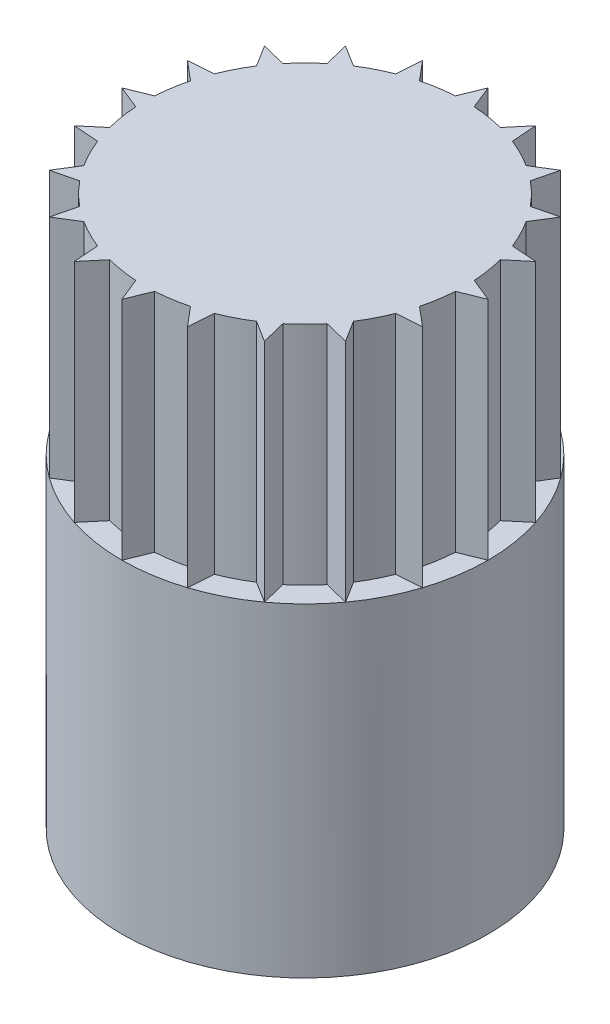
from build123d import *

# Parameters (mm, degrees)
SKETCH1_R           = 4.86
BOSS_EXTRUDE1_DEPTH = 8.6
BOSS_EXTRUDE2_DEPTH = 6


with BuildPart() as part:
    # Sketch1 → Boss-Extrude1 (new body)
    with BuildSketch(Plane(origin=(0, 0, 0), x_dir=(1, 0, 0), z_dir=(0, 1, 0))):
        Circle(SKETCH1_R)
    extrude(amount=BOSS_EXTRUDE1_DEPTH)

    # Sketch2 → Boss-Extrude2 (add)
    with BuildSketch(Plane(origin=(0, 8.6, 0), x_dir=(1, 0, 0), z_dir=(0, 1, 0))):
        with BuildLine():
            Line((0, 4.86), (0.250754017, 4.242596189))
            ThreePointArc((0.250754017, 4.242596189), (0.664846476, 4.197675448), (1.072553081, 4.112436004))
            Line((1.072553081, 4.112436004), (1.501822593, 4.622134669))
            Line((1.501822593, 4.622134669), (1.549515564, 3.957461499))
            ThreePointArc((1.549515564, 3.957461499), (1.929459624, 3.786777728), (2.29087121, 3.57972193))
            Line((2.29087121, 3.57972193), (2.856636326, 3.931822593))
            Line((2.856636326, 3.931822593), (2.696599732, 3.284942904))
            ThreePointArc((2.696599732, 3.284942904), (3.00520382, 3.00520382), (3.284942904, 2.696599732))
            Line((3.284942904, 2.696599732), (3.931822593, 2.856636326))
            Line((3.931822593, 2.856636326), (3.57972193, 2.29087121))
            ThreePointArc((3.57972193, 2.29087121), (3.786777728, 1.929459624), (3.957461499, 1.549515564))
            Line((3.957461499, 1.549515564), (4.622134669, 1.501822593))
            Line((4.622134669, 1.501822593), (4.112436004, 1.072553081))
            ThreePointArc((4.112436004, 1.072553081), (4.197675448, 0.664846476), (4.242596189, 0.250754017))
            Line((4.242596189, 0.250754017), (4.86, 0))
            Line((4.86, 0), (4.242596189, -0.250754017))
            ThreePointArc((4.242596189, -0.250754017), (4.197675448, -0.664846476), (4.112436004, -1.072553081))
            Line((4.112436004, -1.072553081), (4.622134669, -1.501822593))
            Line((4.622134669, -1.501822593), (3.957461499, -1.549515564))
            ThreePointArc((3.957461499, -1.549515564), (3.786777728, -1.929459624), (3.57972193, -2.29087121))
            Line((3.57972193, -2.29087121), (3.931822593, -2.856636326))
            Line((3.931822593, -2.856636326), (3.284942904, -2.696599732))
            ThreePointArc((3.284942904, -2.696599732), (3.00520382, -3.00520382), (2.696599732, -3.284942904))
            Line((2.696599732, -3.284942904), (2.856636326, -3.931822593))
            Line((2.856636326, -3.931822593), (2.29087121, -3.57972193))
            ThreePointArc((2.29087121, -3.57972193), (1.929459624, -3.786777728), (1.549515564, -3.957461499))
            Line((1.549515564, -3.957461499), (1.501822593, -4.622134669))
            Line((1.501822593, -4.622134669), (1.072553081, -4.112436004))
            ThreePointArc((1.072553081, -4.112436004), (0.664846476, -4.197675448), (0.250754017, -4.242596189))
            Line((0.250754017, -4.242596189), (0, -4.86))
            Line((0, -4.86), (-0.250754017, -4.242596189))
            ThreePointArc((-0.250754017, -4.242596189), (-0.664846476, -4.197675448), (-1.072553081, -4.112436004))
            Line((-1.072553081, -4.112436004), (-1.501822593, -4.622134669))
            Line((-1.501822593, -4.622134669), (-1.549515564, -3.957461499))
            ThreePointArc((-1.549515564, -3.957461499), (-1.929459624, -3.786777728), (-2.29087121, -3.57972193))
            Line((-2.29087121, -3.57972193), (-2.856636326, -3.931822593))
            Line((-2.856636326, -3.931822593), (-2.696599732, -3.284942904))
            ThreePointArc((-2.696599732, -3.284942904), (-3.00520382, -3.00520382), (-3.284942904, -2.696599732))
            Line((-3.284942904, -2.696599732), (-3.931822593, -2.856636326))
            Line((-3.931822593, -2.856636326), (-3.57972193, -2.29087121))
            ThreePointArc((-3.57972193, -2.29087121), (-3.786777728, -1.929459624), (-3.957461499, -1.549515564))
            Line((-3.957461499, -1.549515564), (-4.622134669, -1.501822593))
            Line((-4.622134669, -1.501822593), (-4.112436004, -1.072553081))
            ThreePointArc((-4.112436004, -1.072553081), (-4.197675448, -0.664846476), (-4.242596189, -0.250754017))
            Line((-4.242596189, -0.250754017), (-4.86, 0))
            Line((-4.86, 0), (-4.242596189, 0.250754017))
            ThreePointArc((-4.242596189, 0.250754017), (-4.197675448, 0.664846476), (-4.112436004, 1.072553081))
            Line((-4.112436004, 1.072553081), (-4.622134669, 1.501822593))
            Line((-4.622134669, 1.501822593), (-3.957461499, 1.549515564))
            ThreePointArc((-3.957461499, 1.549515564), (-3.786777728, 1.929459624), (-3.57972193, 2.29087121))
            Line((-3.57972193, 2.29087121), (-3.931822593, 2.856636326))
            Line((-3.931822593, 2.856636326), (-3.284942904, 2.696599732))
            ThreePointArc((-3.284942904, 2.696599732), (-3.00520382, 3.00520382), (-2.696599732, 3.284942904))
            Line((-2.696599732, 3.284942904), (-2.856636326, 3.931822593))
            Line((-2.856636326, 3.931822593), (-2.29087121, 3.57972193))
            ThreePointArc((-2.29087121, 3.57972193), (-1.929459624, 3.786777728), (-1.549515564, 3.957461499))
            Line((-1.549515564, 3.957461499), (-1.501822593, 4.622134669))
            Line((-1.501822593, 4.622134669), (-1.072553081, 4.112436004))
            ThreePointArc((-1.072553081, 4.112436004), (-0.664846476, 4.197675448), (-0.250754017, 4.242596189))
            Line((-0.250754017, 4.242596189), (0, 4.86))
        make_face()
    extrude(amount=BOSS_EXTRUDE2_DEPTH)


solid = part.part
